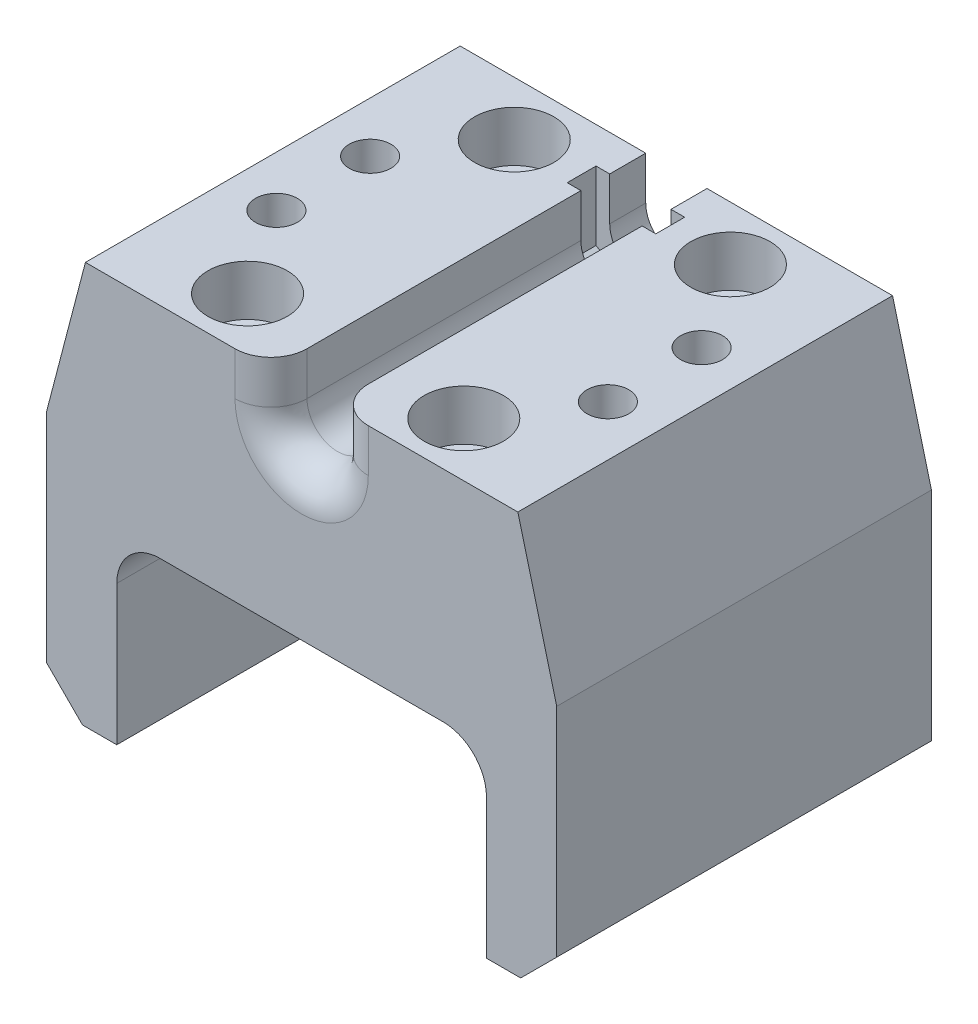
from build123d import *

# Parameters (mm, degrees)
BOSS_EXTRUDE1_DEPTH = 26
CUT_EXTRUDE8_DEPTH  = 81.232163127
FILLET1_R           = 6
SKETCH2_R           = 2.9
SKETCH2_R_2         = 3.05
CUT_EXTRUDE1_DEPTH  = 29
SKETCH3_R           = 5.5
CUT_EXTRUDE2_DEPTH  = 7
CHAMFER2_SIZE       = 5
CUT_EXTRUDE9_DEPTH  = 81.232163127
CUT_EXTRUDE10_START = -5
CUT_EXTRUDE10_DEPTH = 4
FILLET2_R           = 5
SKETCH12_R          = 3.05
CUT_EXTRUDE11_DEPTH = 4
FILLET3_R           = 2


with BuildPart() as part:
    # Sketch1 → Boss-Extrude1 (new, symmetric)
    with BuildSketch(Plane.XY):
        Polygon((35.4, 6), (-35.4, 6), (-35.4, -49.8), (-25.65, -49.8), (-25.65, -24.4), (25.65, -24.4), (25.65, -49.8), (35.4, -49.8), align=None)
    extrude(amount=BOSS_EXTRUDE1_DEPTH, both=True)

    # Sketch9 → Cut-Extrude8 (cut, through all)
    with BuildSketch(Plane.XY.offset(26)):
        Polygon((-30, 6), (-35.4, -14.65), (-35.4, 6), align=None)
        Polygon((35.4, 6), (30, 6), (35.4, -14.65), align=None)
    extrude(amount=-CUT_EXTRUDE8_DEPTH, mode=Mode.SUBTRACT)

    # Fillet1
    fillet1_edges = [part.edges().sort_by_distance(p)[0] for p in [
        (25.65, -24.4, 0),
        (-25.65, -24.4, 0),
    ]]
    fillet(fillet1_edges, radius=FILLET1_R)

    # Sketch2 → Cut-Extrude1 (cut)
    with BuildSketch(Plane(origin=(0, 6, 0), x_dir=(1, 0, 0), z_dir=(0, 1, 0))):
        with Locations((-23, 6.5)):
            Circle(SKETCH2_R)
        with Locations((-23, -6.5)):
            Circle(SKETCH2_R)
        with Locations((-15, 18.5)):
            Circle(SKETCH2_R_2)
        with Locations((23, -6.5)):
            Circle(SKETCH2_R)
        with Locations((23, 6.5)):
            Circle(SKETCH2_R)
        with Locations((15, 18.5)):
            Circle(SKETCH2_R_2)
        with Locations((15, -18.5)):
            Circle(SKETCH2_R_2)
        with Locations((-15, -18.5)):
            Circle(SKETCH2_R_2)
    extrude(amount=-CUT_EXTRUDE1_DEPTH, mode=Mode.SUBTRACT)

    # Sketch3 → Cut-Extrude2 (cut)
    with BuildSketch(Plane(origin=(0, 6, 0), x_dir=(1, 0, 0), z_dir=(0, 1, 0))):
        with Locations((-15, 18.5)):
            Circle(SKETCH3_R)
        with Locations((15, 18.5)):
            Circle(SKETCH3_R)
        with Locations((-15, -18.5)):
            Circle(SKETCH3_R)
        with Locations((15, -18.5)):
            Circle(SKETCH3_R)
    extrude(amount=-CUT_EXTRUDE2_DEPTH, mode=Mode.SUBTRACT)

    # Chamfer2
    chamfer2_edges = [part.edges().sort_by_distance(p)[0] for p in [
        (-35.4, -49.8, 0),
        (35.4, -49.8, 0),
    ]]
    chamfer(chamfer2_edges, length=CHAMFER2_SIZE)

    # Sketch10 → Cut-Extrude9 (cut, through all)
    with BuildSketch(Plane(origin=(0, 0, -26), x_dir=(-1, 0, 0), z_dir=(0, 0, -1))):
        with BuildLine():
            Line((-4.25, 0), (-4.25, 11.491510708))
            Line((-4.25, 11.491510708), (4.25, 11.491510708))
            Line((4.25, 11.491510708), (4.25, 0))
            ThreePointArc((4.25, 0), (0, -4.25), (-4.25, 0))
        make_face()
    extrude(amount=-CUT_EXTRUDE9_DEPTH, mode=Mode.SUBTRACT)

    # Sketch11 → Cut-Extrude10 (cut)
    with BuildSketch(Plane(origin=(0, 0, -26), x_dir=(-1, 0, 0), z_dir=(0, 0, -1)).offset(CUT_EXTRUDE10_START)):
        Polygon((-6.15, 3.550704156), (-6.15, 9.910448096), (6.15, 9.910448096), (6.15, 3.550704156), (6.15, -3.550704156), (0, -7.101408311), (-6.15, -3.550704156), align=None)
    extrude(amount=-CUT_EXTRUDE10_DEPTH, mode=Mode.SUBTRACT)

    # Fillet2
    fillet2_edges = [part.edges().sort_by_distance(p)[0] for p in [
        (4.25, 3, 26),
        (-4.25, 3, 26),
        (0, -4.25, 26),
    ]]
    fillet(fillet2_edges, radius=FILLET2_R)

    # Sketch12 → Cut-Extrude11 (cut)
    with BuildSketch(Plane(origin=(0, -23, 0), x_dir=(1, 0, 0), z_dir=(0, 1, 0))):
        with Locations((-15, 18.5)):
            Circle(SKETCH12_R)
        with Locations((15, 18.5)):
            Circle(SKETCH12_R)
        with Locations((15, -18.5)):
            Circle(SKETCH12_R)
        with Locations((-15, -18.5)):
            Circle(SKETCH12_R)
    extrude(amount=-CUT_EXTRUDE11_DEPTH, mode=Mode.SUBTRACT)

    # Fillet3
    fillet3_edges = [part.edges().sort_by_distance(p)[0] for p in [
        (-25.9, -23, -6.5),
        (-25.9, -23, 6.5),
        (20.1, -23, -6.5),
        (20.1, -23, 6.5),
    ]]
    fillet(fillet3_edges, radius=FILLET3_R)


solid = part.part
